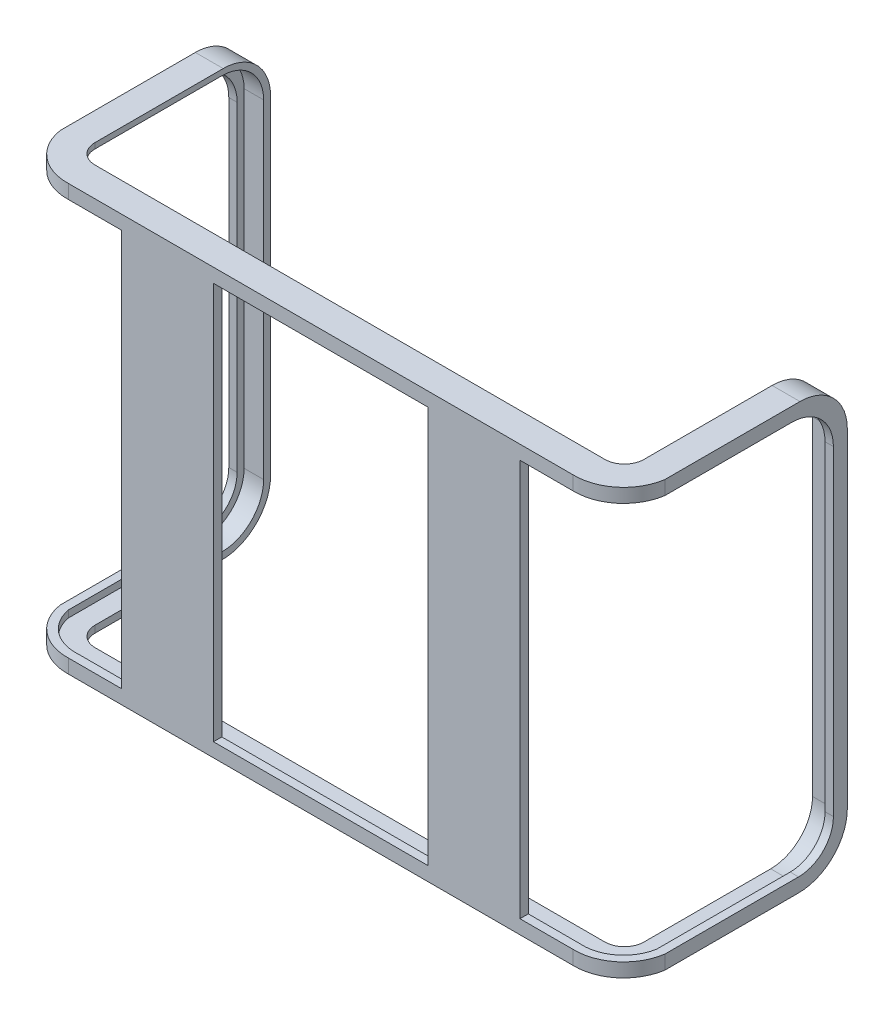
from build123d import *

# Parameters (mm, degrees)
EXTRUDE_1_DEPTH        = 105.5
EXTRUDE_3_DEPTH        = 7
FILLET_2_R             = 15
SKETCH_6_W             = 33
SKETCH_6_H             = 3
EXTRUDE_4_DEPTH        = 148
EXTRUDE_START          = 3
EXTRUDE_5_DEPTH        = 3
EXTRUDE_6_DEPTH        = 2.5
FILLET_3_R             = 7
EXTRUDE_START_2        = 2
EXTRUDE_7_DEPTH        = 2
EXTRUDE_8_DEPTH        = 3
FILLET_4_R             = 15
FILLET_5_R             = 17
FILLET_3_OF_MIRROR_1_R = 7
FILLET_4_OF_MIRROR_1_R = 15
FILLET_5_OF_MIRROR_1_R = 17
EXTRUDE_9_OUTLINE_W    = 77
EXTRUDE_9_OUTLINE_H    = 3
EXTRUDE_9_DEPTH        = 2.5
EXTRUDE_START_3        = 145
EXTRUDE_9_2_OUTLINE_W  = 77
EXTRUDE_9_2_OUTLINE_H  = 3
EXTRUDE_9_2_DEPTH      = 3


# Read off the part's stored shape, not the designer's step: 보스-돌출9
with BuildPart() as part:
    # 스케치1 → 보스-돌출1 (new, symmetric)
    with BuildSketch(Plane(origin=(0, 0, 0), x_dir=(0, 0, -1), z_dir=(1, 0, 0))):
        Polygon((0, 0), (7.5, 0), (7.5, -2.5), (-3, -2.5), (-3, 0), align=None)
    extrude(amount=EXTRUDE_1_DEPTH, both=True)

    # 스케치5 → 보스-돌출3 (add)
    with BuildSketch(Plane(origin=(105.5, 0, 0), x_dir=(0, 0, -1), z_dir=(1, 0, 0))):
        with BuildLine():
            Line((7.5, 0), (60, 0))
            ThreePointArc((60, 0), (70.606601718, 4.393398282), (75, 15))
            Line((75, 15), (75, 148))
            Line((75, 148), (77.5, 148))
            Line((77.5, 148), (77.5, 15))
            ThreePointArc((77.5, 15), (72.374368671, 2.625631329), (60, -2.5))
            Line((60, -2.5), (7.5, -2.5))
            Line((7.5, -2.5), (7.5, 0))
        make_face()
    extrude_3 = extrude(amount=-EXTRUDE_3_DEPTH)

    # 필렛2
    # the kernel refuses this fillet: 15 mm, written as the material it takes off along each edge
    with BuildSketch(Plane(origin=(-105.5, -38.272720053, 3), x_dir=(0, 0, -1), z_dir=(0, 1, 0))) as fillet_2_piece_1:
        with BuildLine():
            CenterArc((15, -14.309088021), FILLET_2_R, 107.457603124, 72.542396876)
            Line((0, -14.309088021), (-0.3, -14.309088021))
            Line((-0.3, -14.309088021), (-0.3, 0))
            Line((-0.3, 0), (0, 0.3))
            ThreePointArc((0, 0.3), (5.25, 0.3), (10.41, 0.28618176))
            Line((10.41, 0.28618176), (10.5, 0))
        make_face()
    extrude(amount=74.045440106, mode=Mode.SUBTRACT)
    with BuildSketch(Plane(origin=(105.5, -40, 3), x_dir=(-1, 0, 0), z_dir=(0, 1, 0))) as fillet_2_piece_2:
        with BuildLine():
            CenterArc((FILLET_2_R, -FILLET_2_R), FILLET_2_R, 90, 90)
            Line((0, -FILLET_2_R), (-FILLET_2_R * 0.02, -FILLET_2_R))
            Line((-FILLET_2_R * 0.02, -FILLET_2_R), (-FILLET_2_R * 0.02, FILLET_2_R * 0.02))
            Line((-FILLET_2_R * 0.02, FILLET_2_R * 0.02), (FILLET_2_R, FILLET_2_R * 0.02))
            Line((FILLET_2_R, FILLET_2_R * 0.02), (FILLET_2_R, 0))
        make_face()
    extrude(amount=77.5, mode=Mode.SUBTRACT)

    # 스케치6 → 보스-돌출4 (add)
    with BuildSketch(Plane(origin=(0, 0, 0), x_dir=(1, 0, 0), z_dir=(0, 1, 0))):
        with Locations((55, -1.5)):
            Rectangle(SKETCH_6_W, SKETCH_6_H)
        with Locations((-55, -1.5)):
            Rectangle(SKETCH_6_W, SKETCH_6_H)
    extrude(amount=EXTRUDE_4_DEPTH)

    # 스케치7 → 보스-돌출5 (add)
    with BuildSketch(Plane(origin=(105.5, 0, 0), x_dir=(0, 0, -1), z_dir=(1, 0, 0)).offset(EXTRUDE_START)):
        with BuildLine():
            Line((75, 148), (72.5, 148))
            Line((72.5, 148), (72.5, 15))
            ThreePointArc((72.5, 15), (68.838834765, 6.161165235), (60, 2.5))
            Line((60, 2.5), (12, 2.5))
            Line((12, 2.5), (12, 0))
            Line((12, 0), (12, -2.5))
            Line((12, -2.5), (60, -2.5))
            ThreePointArc((60, -2.5), (72.374368671, 2.625631329), (77.5, 15))
            Line((77.5, 15), (77.5, 148))
            Line((77.5, 148), (75, 148))
        make_face()
    extrude_5 = extrude(amount=-EXTRUDE_5_DEPTH)

    # 스케치8 → 보스-돌출6 (add, symmetric)
    with BuildSketch(Plane(origin=(0, 0, 0), x_dir=(1, 0, 0), z_dir=(0, 1, 0))):
        with BuildLine():
            Line((105.5, 12), (108.5, 12))
            ThreePointArc((108.5, 12), (102.347106917, 1.078432733), (90.493621255, -2.999998644))
            Line((90.493621255, -2.999998644), (90.493621255, -0.038661453))
            ThreePointArc((90.493621255, -0.038661453), (100.242988055, 3.180774174), (105.5, 12))
        make_face()
    extrude_6 = extrude(amount=EXTRUDE_6_DEPTH, both=True)

    # 필렛3
    fillet_3_edges = [part.edges().sort_by_distance(p)[0] for p in [
        (98.5, -1.25, -7.5),
    ]]
    fillet(fillet_3_edges, radius=FILLET_3_R)

    # 스케치10 → 보스-돌출7 (add)
    with BuildSketch(Plane(origin=(0, 148, 0), x_dir=(1, 0, 0), z_dir=(0, 1, 0)).offset(EXTRUDE_START_2)):
        with BuildLine():
            Line((98.5, 77.5), (98.5, 14.5))
            ThreePointArc((98.5, 14.5), (96.449747468, 9.550252532), (91.5, 7.5))
            Line((91.5, 7.5), (0, 7.5))
            Line((0, 7.5), (0, -2.999998644))
            Line((0, -2.999998644), (90.493621255, -2.999998644))
            ThreePointArc((90.493621255, -2.999998644), (102.347106917, 1.078432733), (108.5, 12))
            Line((108.5, 12), (108.5, 77.5))
            Line((108.5, 77.5), (98.5, 77.5))
        make_face()
    extrude_7 = extrude(amount=-EXTRUDE_7_DEPTH)

    # 스케치11 → 보스-돌출8 (add)
    with BuildSketch(Plane.XZ.offset(-148)):
        with BuildLine():
            Line((105.5, -60), (105.5, -72.5))
            Line((105.5, -72.5), (108.5, -72.5))
            Line((108.5, -72.5), (108.5, -60))
            Line((108.5, -60), (108.5, -12))
            ThreePointArc((108.5, -12), (102.347115112, -1.078439559), (90.493642574, 2.999999322))
            Line((90.493642574, 2.999999322), (71.5, 3))
            Line((71.5, 3), (71.5, 0))
            Line((71.5, 0), (90.493621255, 0.038661453))
            ThreePointArc((90.493621255, 0.038661453), (100.242988055, -3.180774174), (105.5, -12))
            Line((105.5, -12), (105.5, -60))
        make_face()
    extrude_8 = extrude(amount=EXTRUDE_8_DEPTH)

    # 필렛4
    fillet_4_edges = [part.edges().sort_by_distance(p)[0] for p in [
        (107, 145, -72.5),
        (102, 148, -75),
    ]]
    fillet(fillet_4_edges, radius=FILLET_4_R)

    # 필렛5
    fillet_5_edges = [part.edges().sort_by_distance(p)[0] for p in [
        (103.5, 150, -77.5),
    ]]
    fillet(fillet_5_edges, radius=FILLET_5_R)

    # 대칭 복사1: 보스-돌출3, 보스-돌출5, 보스-돌출6, 보스-돌출7, 보스-돌출8 across plane
    add(extrude_3.mirror(Plane(origin=(0, 0, 0), x_dir=(0, 0, 1), z_dir=(1, 0, 0))))
    add(extrude_5.mirror(Plane(origin=(0, 0, 0), x_dir=(0, 0, 1), z_dir=(1, 0, 0))))
    add(extrude_6.mirror(Plane(origin=(0, 0, 0), x_dir=(0, 0, 1), z_dir=(1, 0, 0))))
    add(extrude_7.mirror(Plane(origin=(0, 0, 0), x_dir=(0, 0, 1), z_dir=(1, 0, 0))))
    add(extrude_8.mirror(Plane(origin=(0, 0, 0), x_dir=(0, 0, 1), z_dir=(1, 0, 0))))

    # 필렛3 of 대칭 복사1
    fillet_3_of_mirror_1_edges = [part.edges().sort_by_distance(p)[0] for p in [
        (-98.5, -1.25, -7.5),
    ]]
    fillet(fillet_3_of_mirror_1_edges, radius=FILLET_3_OF_MIRROR_1_R)

    # 필렛4 of 대칭 복사1
    fillet_4_of_mirror_1_edges = [part.edges().sort_by_distance(p)[0] for p in [
        (-107, 145, -72.5),
        (-102, 148, -75),
    ]]
    fillet(fillet_4_of_mirror_1_edges, radius=FILLET_4_OF_MIRROR_1_R)

    # 필렛5 of 대칭 복사1
    fillet_5_of_mirror_1_edges = [part.edges().sort_by_distance(p)[0] for p in [
        (-103.5, 150, -77.5),
    ]]
    fillet(fillet_5_of_mirror_1_edges, radius=FILLET_5_OF_MIRROR_1_R)

    # 보스-돌출9 outline → 보스-돌출9 (add)
    with BuildSketch(Plane(origin=(0, 0, 0), x_dir=(1, 0, 0), z_dir=(0, 1, 0))):
        Polygon((-90.493621255, 0), (-90.493631914, -2.999999778), (-71.5, -3), (-71.5, 0), align=None)
        with Locations((0, -1.5)):
            Rectangle(EXTRUDE_9_OUTLINE_W, EXTRUDE_9_OUTLINE_H)
        Polygon((90.493635587, 0), (71.5, 0), (71.5, -3), (90.493642574, -3), (90.493621255, -0.038661453), align=None)
    extrude(amount=EXTRUDE_9_DEPTH)

    # Extrude 9 2 outline → Extrude 9 2 (add)
    with BuildSketch(Plane(origin=(0, 0, 0), x_dir=(1, 0, 0), z_dir=(0, 1, 0)).offset(EXTRUDE_START_3)):
        with Locations((0, -1.5)):
            Rectangle(EXTRUDE_9_2_OUTLINE_W, EXTRUDE_9_2_OUTLINE_H)
    extrude(amount=EXTRUDE_9_2_DEPTH)


solid = part.part
